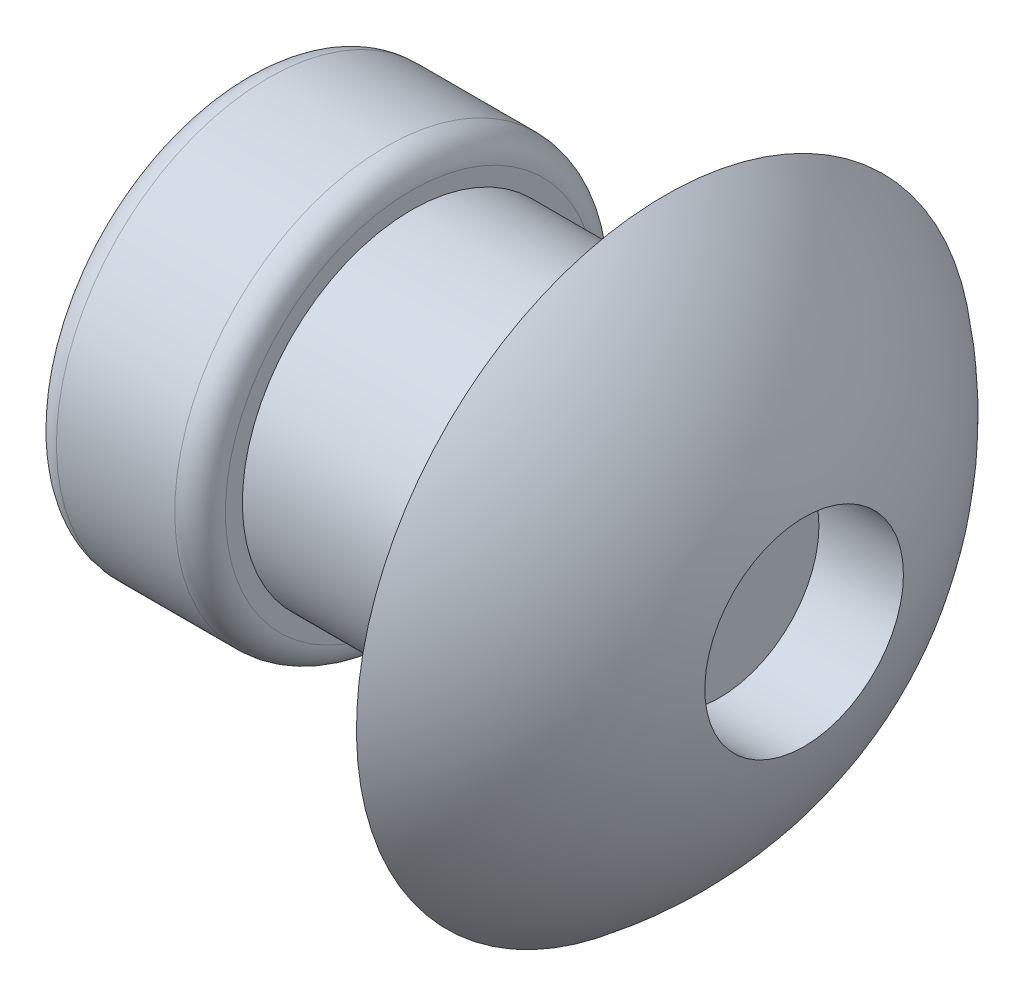
from build123d import *

# Parameters (mm, degrees)
FILLET1_R      = 0.5
CHAMFER1_SIZE  = 2.35
CHAMFER1_SIZE2 = 0.629680602
SKETCH_1_W     = 29
SKETCH_1_H     = 1.175


with BuildPart() as part:
    # Sketch1 → Base-Revolve (revolve)
    with BuildSketch(Plane(origin=(-11.603452862, 14.723452862, 0), x_dir=(0, -1, 0), z_dir=(0, 0, 1))):
        with BuildLine():
            Line((16.923452862, 12.103452862), (16.598206218, 12.103452862))
            ThreePointArc((16.598206218, 12.103452862), (16.304826689, 11.774384722), (15.898452862, 11.603452862))
            Line((15.898452862, 11.603452862), (14.723452862, 11.603452862))
            Line((14.723452862, 11.603452862), (14.723452862, 46.750877613))
            Line((14.723452862, 46.750877613), (15.898452862, 46.750877613))
            Line((15.898452862, 46.750877613), (15.898452862, 18.750877613))
            ThreePointArc((15.898452862, 18.750877613), (17.272699482, 18.132605809), (18.373452862, 17.103452862))
            Line((18.373452862, 17.103452862), (16.723452862, 17.103452862))
            Line((16.723452862, 17.103452862), (16.723452862, 14.103452862))
            Line((16.723452862, 14.103452862), (16.923452862, 14.103452862))
            ThreePointArc((16.923452862, 14.103452862), (17.135584897, 14.015584897), (17.223452862, 13.803452862))
            Line((17.223452862, 13.803452862), (17.223452862, 12.403452862))
            ThreePointArc((17.223452862, 12.403452862), (17.135584897, 12.191320828), (16.923452862, 12.103452862))
        make_face()
    revolve(axis=Axis((22.234231882, 0, 0), (-1, 0, 0)))

    # Fillet1
    fillet1_edges = [part.edges().sort_by_distance(p)[0] for p in [
        (5.5, 2, 0),
    ]]
    fillet(fillet1_edges, radius=FILLET1_R)

    # Chamfer1
    chamfer1_edges = [part.edges().sort_by_distance(p)[0] for p in [
        (35.14742475, 1.175, 0),
    ]]
    chamfer1_side = [part.faces().sort_by_distance(p)[0] for p in [
        (21.14742475, 1.175, 0),
    ]]
    chamfer(chamfer1_edges, length=CHAMFER1_SIZE, length2=CHAMFER1_SIZE2, reference=chamfer1_side[0])

    # Эскиз1 → Вырез-Повернуть1 (revolve, cut)
    with BuildSketch(Plane(origin=(0, 0, 0), x_dir=(1, 0, 0), z_dir=(0, 1, 0))):
        with Locations((20.64742475, 0.5875)):
            Rectangle(SKETCH_1_W, SKETCH_1_H)
    revolve(axis=Axis((35.14742475, 0, 0), (-1, 0, 0)), mode=Mode.SUBTRACT)


solid = part.part
